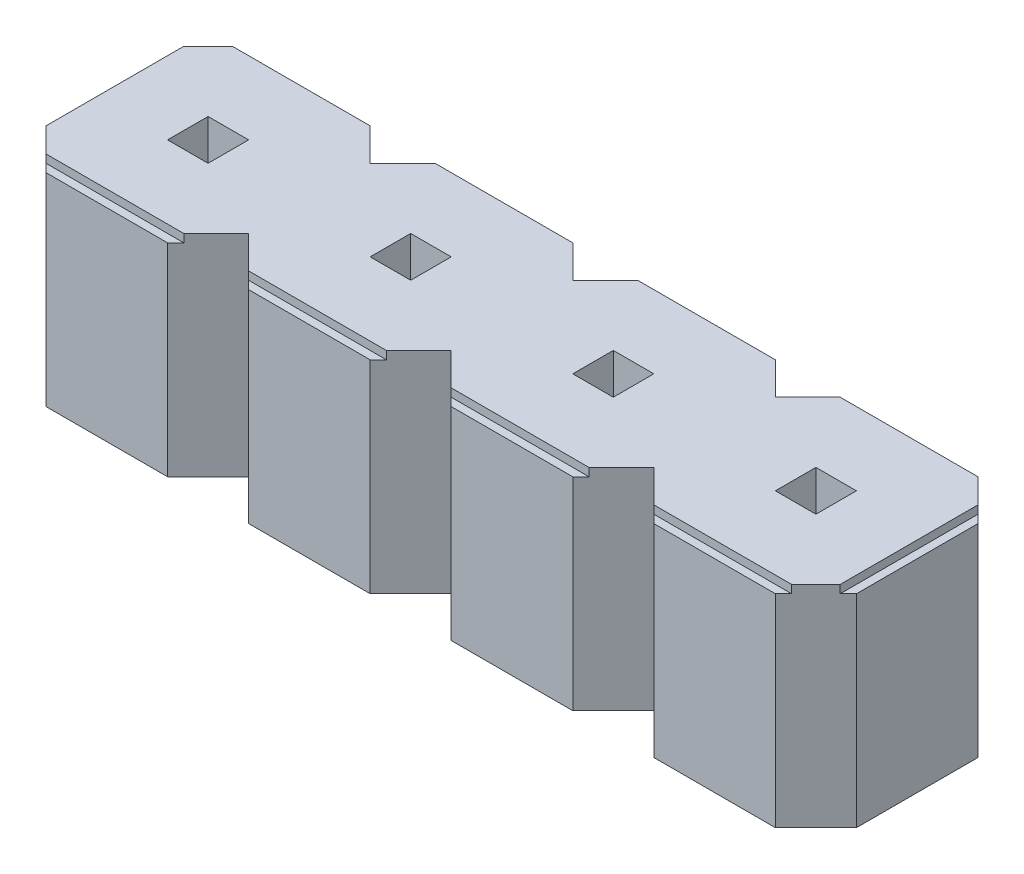
from build123d import *

# Parameters (mm, degrees)
BOSS_EXTRUDE1_DEPTH = 1.3
SKETCH2_W           = 11.59712349
SKETCH2_H           = 4.16940885
SKETCH2_W_2         = 9.8
SKETCH2_H_2         = 2.3
CUT_EXTRUDE1_DEPTH  = 0.1
SKETCH3_W           = 0.5
SKETCH3_H           = 0.5
CUT_EXTRUDE2_DEPTH  = 10.213305596


with BuildPart() as part:
    # Sketch1 → Boss-Extrude1 (new, symmetric)
    with BuildSketch(Plane(origin=(0, 0, 0), x_dir=(1, 0, 0), z_dir=(0, 1, 0))):
        Polygon((-0.75, 1.25), (-1.25, 0.75), (-1.25, -0.75), (-0.75, -1.25), (0.75, -1.25), (1.25, -0.75), (1.75, -1.25), (3.25, -1.25), (3.75, -0.75), (4.25, -1.25), (5.75, -1.25), (6.25, -0.75), (6.75, -1.25), (8.25, -1.25), (8.75, -0.75), (8.75, 0.75), (8.25, 1.25), (6.75, 1.25), (6.25, 0.75), (5.75, 1.25), (4.25, 1.25), (3.75, 0.75), (3.25, 1.25), (1.75, 1.25), (1.25, 0.75), (0.75, 1.25), align=None)
    extrude(amount=BOSS_EXTRUDE1_DEPTH, both=True)

    # Sketch2 → Cut-Extrude1 (cut)
    with BuildSketch(Plane(origin=(0, 1.3, 0), x_dir=(1, 0, 0), z_dir=(0, 1, 0))):
        with Locations((3.75, 0)):
            Rectangle(SKETCH2_W, SKETCH2_H)
        with Locations((3.75, 0)):
            Rectangle(SKETCH2_W_2, SKETCH2_H_2, mode=Mode.SUBTRACT)
    extrude(amount=-CUT_EXTRUDE1_DEPTH, mode=Mode.SUBTRACT)

    # Sketch3 → Cut-Extrude2 (cut, through all)
    with BuildSketch(Plane(origin=(0, 1.3, 0), x_dir=(1, 0, 0), z_dir=(0, 1, 0))):
        with Locations((2.5, 0)):
            Rectangle(SKETCH3_W, SKETCH3_H)
        Rectangle(SKETCH3_W, SKETCH3_H)
        with Locations((5, 0)):
            Rectangle(SKETCH3_W, SKETCH3_H)
        with Locations((7.5, 0)):
            Rectangle(SKETCH3_W, SKETCH3_H)
    extrude(amount=-CUT_EXTRUDE2_DEPTH, mode=Mode.SUBTRACT)


solid = part.part
